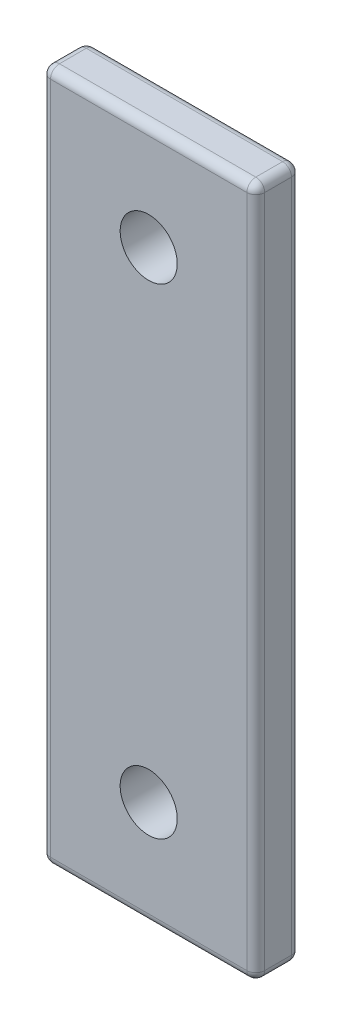
from build123d import *

# Parameters (mm, degrees)
SKETCH1_W           = 48
SKETCH1_H           = 155
BOSS_EXTRUDE1_DEPTH = 10
FILLET1_R           = 2
FILLET2_R           = 2
SKETCH2_R           = 6.4
CUT_EXTRUDE1_DEPTH  = 82.74503043


with BuildPart() as part:
    # Sketch1 → Boss-Extrude1 (new body)
    with BuildSketch(Plane.XY):
        Rectangle(SKETCH1_W, SKETCH1_H)
    extrude(amount=BOSS_EXTRUDE1_DEPTH)

    # Fillet1
    fillet1_edges = [part.edges().sort_by_distance(p)[0] for p in [
        (-24, 0, 10),
        (0, -77.5, 10),
        (24, 0, 10),
        (0, -77.5, 0),
        (-24, 0, 0),
        (0, 77.5, 0),
        (24, 0, 0),
        (0, 77.5, 10),
    ]]
    fillet(fillet1_edges, radius=FILLET1_R)

    # Fillet2
    # the kernel refuses this fillet: 2 mm, written as the material it takes off along each edge
    with BuildSketch(Plane(origin=(-22, 75.5, 8), x_dir=(0, 1, 0), z_dir=(-1, 0, 0))) as fillet2_piece_1_section:
        Polygon((0, 0), (FILLET2_R, 0), (FILLET2_R, -FILLET2_R), (0, -FILLET2_R), align=None)
    fillet2_piece_1 = extrude(amount=FILLET2_R, mode=Mode.PRIVATE)
    fillet2_piece_1 = fillet2_piece_1 - Plane(origin=(-22, 75.5, 8), x_dir=(0, -0.7071067811865475, -0.7071067811865475), z_dir=(-1, 0, 0)) * Sphere(FILLET2_R, mode=Mode.PRIVATE)
    add(fillet2_piece_1, mode=Mode.SUBTRACT)
    with BuildSketch(Plane(origin=(22, 75.5, 8), x_dir=(0, 1, 0), z_dir=(1, 0, 0))) as fillet2_piece_2_section:
        Polygon((0, 0), (FILLET2_R, 0), (FILLET2_R, FILLET2_R), (0, FILLET2_R), align=None)
    fillet2_piece_2 = extrude(amount=FILLET2_R, mode=Mode.PRIVATE)
    fillet2_piece_2 = fillet2_piece_2 - Plane(origin=(22, 75.5, 8), x_dir=(0, -0.7071067811865475, -0.7071067811865475), z_dir=(1, 0, 0)) * Sphere(FILLET2_R, mode=Mode.PRIVATE)
    add(fillet2_piece_2, mode=Mode.SUBTRACT)
    with BuildSketch(Plane(origin=(-22, -75.5, 8), x_dir=(-1, 0, 0), z_dir=(0, -1, 0))) as fillet2_piece_3_section:
        Polygon((0, 0), (FILLET2_R, 0), (FILLET2_R, -FILLET2_R), (0, -FILLET2_R), align=None)
    fillet2_piece_3 = extrude(amount=FILLET2_R, mode=Mode.PRIVATE)
    fillet2_piece_3 = fillet2_piece_3 - Plane(origin=(-22, -75.5, 8), x_dir=(0.7071067811865475, 0, -0.7071067811865475), z_dir=(0, -1, 0)) * Sphere(FILLET2_R, mode=Mode.PRIVATE)
    add(fillet2_piece_3, mode=Mode.SUBTRACT)
    with BuildSketch(Plane(origin=(22, -75.5, 8), x_dir=(1, 0, 0), z_dir=(0, -1, 0))) as fillet2_piece_4_section:
        Polygon((0, 0), (FILLET2_R, 0), (FILLET2_R, FILLET2_R), (0, FILLET2_R), align=None)
    fillet2_piece_4 = extrude(amount=FILLET2_R, mode=Mode.PRIVATE)
    fillet2_piece_4 = fillet2_piece_4 - Plane(origin=(22, -75.5, 8), x_dir=(-0.7071067811865475, 0, -0.7071067811865475), z_dir=(0, -1, 0)) * Sphere(FILLET2_R, mode=Mode.PRIVATE)
    add(fillet2_piece_4, mode=Mode.SUBTRACT)
    with BuildSketch(Plane(origin=(22, -75.5, 2), x_dir=(1, 0, 0), z_dir=(0, -1, 0))) as fillet2_piece_5_section:
        Polygon((0, 0), (FILLET2_R, 0), (FILLET2_R, -FILLET2_R), (0, -FILLET2_R), align=None)
    fillet2_piece_5 = extrude(amount=FILLET2_R, mode=Mode.PRIVATE)
    fillet2_piece_5 = fillet2_piece_5 - Plane(origin=(22, -75.5, 2), x_dir=(-0.7071067811865475, 0, 0.7071067811865475), z_dir=(0, -1, 0)) * Sphere(FILLET2_R, mode=Mode.PRIVATE)
    add(fillet2_piece_5, mode=Mode.SUBTRACT)
    with BuildSketch(Plane(origin=(-22, -75.5, 2), x_dir=(-1, 0, 0), z_dir=(0, -1, 0))) as fillet2_piece_6_section:
        Polygon((0, 0), (FILLET2_R, 0), (FILLET2_R, FILLET2_R), (0, FILLET2_R), align=None)
    fillet2_piece_6 = extrude(amount=FILLET2_R, mode=Mode.PRIVATE)
    fillet2_piece_6 = fillet2_piece_6 - Plane(origin=(-22, -75.5, 2), x_dir=(0.7071067811865475, 0, 0.7071067811865475), z_dir=(0, -1, 0)) * Sphere(FILLET2_R, mode=Mode.PRIVATE)
    add(fillet2_piece_6, mode=Mode.SUBTRACT)
    with BuildSketch(Plane(origin=(22, 75.5, 2), x_dir=(0, 1, 0), z_dir=(1, 0, 0))) as fillet2_piece_7_section:
        Polygon((0, 0), (FILLET2_R, 0), (FILLET2_R, -FILLET2_R), (0, -FILLET2_R), align=None)
    fillet2_piece_7 = extrude(amount=FILLET2_R, mode=Mode.PRIVATE)
    fillet2_piece_7 = fillet2_piece_7 - Plane(origin=(22, 75.5, 2), x_dir=(0, -0.7071067811865475, 0.7071067811865475), z_dir=(1, 0, 0)) * Sphere(FILLET2_R, mode=Mode.PRIVATE)
    add(fillet2_piece_7, mode=Mode.SUBTRACT)
    with BuildSketch(Plane(origin=(-22, 75.5, 2), x_dir=(0, 1, 0), z_dir=(-1, 0, 0))) as fillet2_piece_8_section:
        Polygon((0, 0), (FILLET2_R, 0), (FILLET2_R, FILLET2_R), (0, FILLET2_R), align=None)
    fillet2_piece_8 = extrude(amount=FILLET2_R, mode=Mode.PRIVATE)
    fillet2_piece_8 = fillet2_piece_8 - Plane(origin=(-22, 75.5, 2), x_dir=(0, -0.7071067811865475, 0.7071067811865475), z_dir=(-1, 0, 0)) * Sphere(FILLET2_R, mode=Mode.PRIVATE)
    add(fillet2_piece_8, mode=Mode.SUBTRACT)
    with BuildSketch(Plane(origin=(24, -77.5, 2), x_dir=(-1, 0, 0), z_dir=(0, 0, 1)), Plane(origin=(24, 77.5, 2), x_dir=(0, -1, 0), z_dir=(0, 0, 1))) as fillet2_piece_9:
        with BuildLine():
            CenterArc((FILLET2_R, -FILLET2_R), FILLET2_R, 90, 90)
            Line((0, -FILLET2_R), (0, 0))
            Line((0, 0), (FILLET2_R, 0))
        make_face()
    extrude(amount=6, mode=Mode.SUBTRACT)
    with BuildSketch(Plane(origin=(-24, -77.5, 2), x_dir=(1, 0, 0), z_dir=(0, 0, 1)), Plane(origin=(-24, 77.5, 2), x_dir=(0, -1, 0), z_dir=(0, 0, 1))) as fillet2_piece_10:
        with BuildLine():
            CenterArc((FILLET2_R, FILLET2_R), FILLET2_R, 180, 90)
            Line((0, FILLET2_R), (0, 0))
            Line((0, 0), (FILLET2_R, 0))
        make_face()
    extrude(amount=6, mode=Mode.SUBTRACT)

    # Sketch2 → Cut-Extrude1 (cut, through all)
    with BuildSketch(Plane(origin=(0, 0, 0), x_dir=(-1, 0, 0), z_dir=(0, 0, -1))):
        with Locations((0, 53.85)):
            Circle(SKETCH2_R)
    cut_extrude1 = extrude(amount=-CUT_EXTRUDE1_DEPTH, mode=Mode.SUBTRACT)

    # Mirror2: Cut-Extrude1 across plane
    add(cut_extrude1.mirror(Plane.ZX), mode=Mode.SUBTRACT)


solid = part.part
